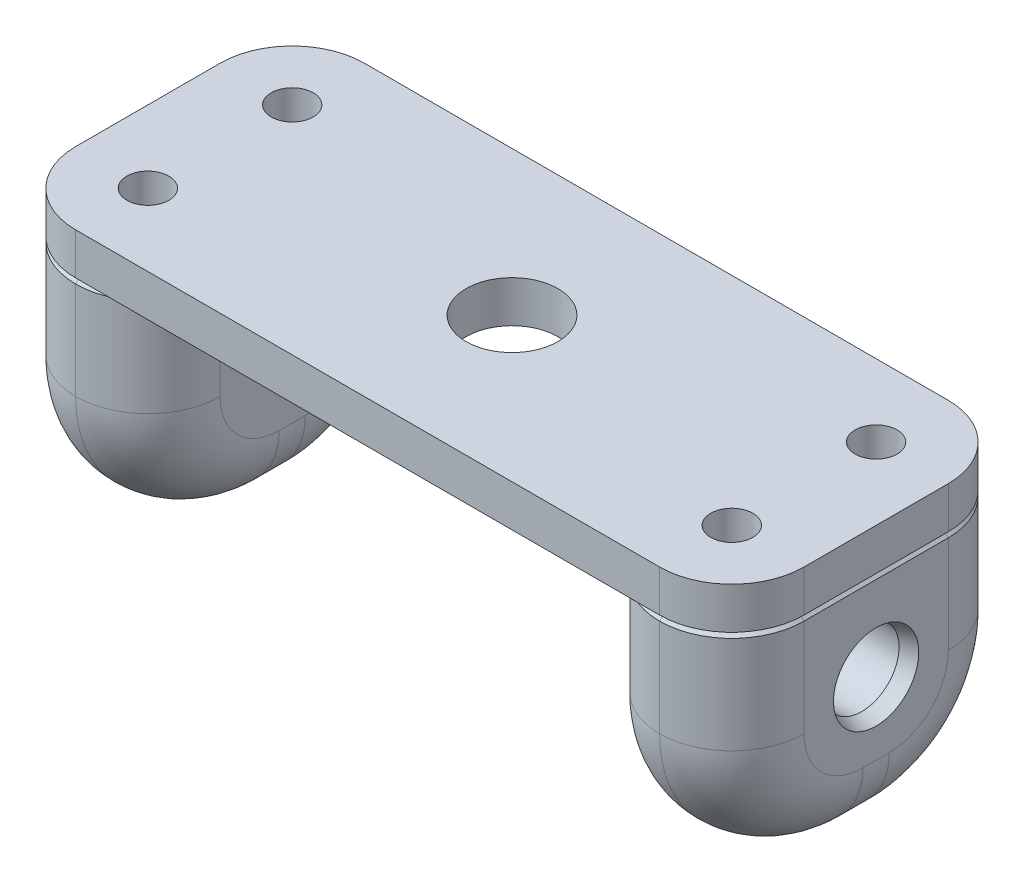
from build123d import *

# Parameters (mm, degrees)
SKETCH2_W             = 22
SKETCH2_H             = 17.825
SKETCH2_R             = 2.85
BOSS_EXTRUDE1_DEPTH   = 5.5
FILLET1_R             = 10
FILLET2_R             = 5.5
SKETCH4_R             = 2.55
CUT_EXTRUDE1_DEPTH    = 5.5
CHAMFER1_SIZE         = 0.4
CHAMFER1_SIZE2        = 1.098990968
CHAMFER4_SIZE         = 0.4
CHAMFER5_SIZE         = 0.4
CHAMFER5_SIZE2        = 1.098990968
BODY_MOVE_COPY1_ANGLE = 180
SKETCH5_W             = 55.5
SKETCH5_H             = 22
SKETCH5_R             = 1.6
SKETCH5_R_2           = 3.5
BOSS_EXTRUDE2_DEPTH   = 3.175
FILLET3_R             = 5.5


with BuildPart() as part:
    # Sketch2 → Boss-Extrude1 (new, symmetric)
    with BuildSketch(Plane(origin=(0, 0, 0), x_dir=(0, 0, -1), z_dir=(1, 0, 0))):
        with Locations((0, -2.0875)):
            Rectangle(SKETCH2_W, SKETCH2_H)
        Circle(SKETCH2_R, mode=Mode.SUBTRACT)
    extrude(amount=BOSS_EXTRUDE1_DEPTH, both=True)

    # Fillet1
    fillet1_edges = [part.edges().sort_by_distance(p)[0] for p in [
        (0, -11, -11),
        (0, -11, 11),
    ]]
    fillet(fillet1_edges, radius=FILLET1_R)

    # Fillet2
    fillet2_edges = [part.edges().sort_by_distance(p)[0] for p in [
        (-5.5, 2.9125, -11),
        (-5.5, -8.071067812, -8.071067812),
        (-5.5, -8.071067812, 8.071067812),
        (5.5, 2.9125, -11),
        (5.5, -8.071067812, -8.071067812),
        (5.5, -8.071067812, 8.071067812),
        (-5.5, 2.9125, 11),
        (5.5, 2.9125, 11),
        (-5.5, -11, 0),
        (5.5, -11, 0),
    ]]
    fillet(fillet2_edges, radius=FILLET2_R - 0.0001)  # a hair under: the kernel refuses the full size

    # Sketch4 → Cut-Extrude1 (cut)
    with BuildSketch(Plane(origin=(0, 6.825, 0), x_dir=(1, 0, 0), z_dir=(0, 1, 0))):
        with Locations(Location((0, 5.5, 0), (0, 0, 270))):
            Circle(SKETCH4_R)
        with Locations(Location((0, -5.5, 0), (0, 0, 270))):
            Circle(SKETCH4_R)
    extrude(amount=-CUT_EXTRUDE1_DEPTH, mode=Mode.SUBTRACT)

    # Chamfer1
    chamfer1_edges = [part.edges().sort_by_distance(p)[0] for p in [
        (-5.5, 0, 2.85),
    ]]
    chamfer1_side = [part.faces().sort_by_distance(p)[0] for p in [
        (-5.5, 6.659799367, 0),
    ]]
    chamfer(chamfer1_edges, length=CHAMFER1_SIZE, length2=CHAMFER1_SIZE2, reference=chamfer1_side[0])

    # Chamfer4
    chamfer4_edges = [part.edges().sort_by_distance(p)[0] for p in [
        (-5.5, 6.825, 0),
        (5.5, 6.825, 0),
        (3.889116586, 6.825, 9.389116586),
        (-3.889116586, 6.825, 9.389116586),
        (3.889116586, 6.825, -9.389116586),
        (-3.889116586, 6.825, -9.389116586),
    ]]
    chamfer(chamfer4_edges, length=CHAMFER4_SIZE)

    # Chamfer5
    chamfer5_edges = [part.edges().sort_by_distance(p)[0] for p in [
        (0, 6.825, -8.05),
        (0, 6.825, 2.95),
    ]]
    chamfer5_side = [part.faces().sort_by_distance(p)[0] for p in [
        (0, 6.825, 0),
    ]]
    chamfer(chamfer5_edges, length=CHAMFER5_SIZE, length2=CHAMFER5_SIZE2, reference=chamfer5_side[0])


with BuildPart() as body_2:
    # Body-Move/Copy1: copy of part
    add(part.part.rotate(Axis((0, 0, 0), (0, 1, 0)), BODY_MOVE_COPY1_ANGLE))


with BuildPart() as part_1:
    # Body-Move/Copy3: read off the stored shape, not the designer's step
    # Body-Move/Copy3: moved
    add(part.part.moved(Location((-44.5, 0, 0))))


with BuildPart() as body_3:
    # Sketch5 → Boss-Extrude2 (new body)
    with BuildSketch(Plane(origin=(0, 6.825, 0), x_dir=(1, 0, 0), z_dir=(0, 1, 0))):
        with Locations((-22.25, 0)):
            Rectangle(SKETCH5_W, SKETCH5_H)
        with Locations(Location((-44.5, 5.5, 0), (0, 0, 270))):
            Circle(SKETCH5_R, mode=Mode.SUBTRACT)
        with Locations(Location((0, -5.5, 0), (0, 0, 270))):
            Circle(SKETCH5_R, mode=Mode.SUBTRACT)
        with Locations(Location((0, 5.5, 0), (0, 0, 270))):
            Circle(SKETCH5_R, mode=Mode.SUBTRACT)
        with Locations(Location((-44.5, -5.5, 0), (0, 0, 270))):
            Circle(SKETCH5_R, mode=Mode.SUBTRACT)
        with Locations(Location((-22.25, 0, 0), (0, 0, 270))):
            Circle(SKETCH5_R_2, mode=Mode.SUBTRACT)
    extrude(amount=BOSS_EXTRUDE2_DEPTH)

    # Fillet3
    fillet3_edges = [body_3.edges().sort_by_distance(p)[0] for p in [
        (5.5, 8.4125, 11),
        (-50, 8.4125, 11),
        (-50, 8.4125, -11),
        (5.5, 8.4125, -11),
    ]]
    fillet(fillet3_edges, radius=FILLET3_R)


solid = Compound([body_2.part, part_1.part, body_3.part])
